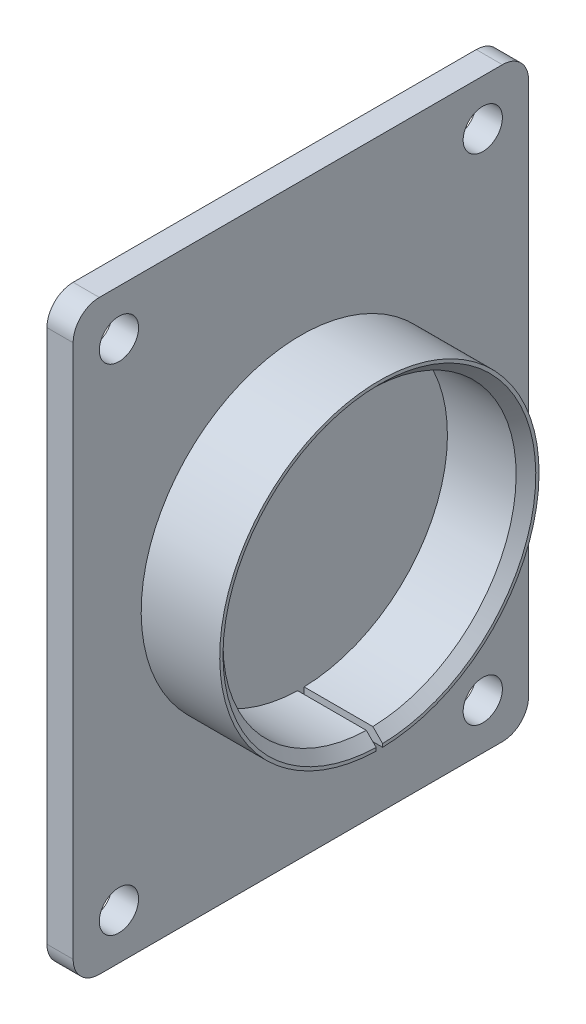
from build123d import *

# Parameters (mm, degrees)
BOSS_EXTRUDE1_DEPTH = 6
SKETCH4_W           = 44.8
SKETCH4_H           = 34.8
SKETCH4_R           = 1.5
BOSS_EXTRUDE3_DEPTH = 2
FILLET1_R           = 2
CHAMFER1_SIZE       = 0.75


with BuildPart() as part:
    # Sketch1 → Boss-Extrude1 (new body)
    with BuildSketch(Plane.YZ):
        with BuildLine():
            Line((-12.197438256, -0.25), (-11.197209474, -0.25))
            ThreePointArc((-11.197209474, -0.25), (11.2, 0), (-11.197209474, 0.25))
            Line((-11.197209474, 0.25), (-12.197438256, 0.25))
            ThreePointArc((-12.197438256, 0.25), (12.2, 0), (-12.197438256, -0.25))
        make_face()
    extrude(amount=BOSS_EXTRUDE1_DEPTH)

    # Sketch4 → Boss-Extrude3 (add)
    with BuildSketch(Plane(origin=(0, 0, 0), x_dir=(0, -1, 0), z_dir=(-1, 0, 0))):
        Rectangle(SKETCH4_W, SKETCH4_H)
        with Locations((-18.9, 13.9)):
            Circle(SKETCH4_R, mode=Mode.SUBTRACT)
        with Locations((18.9, 13.9)):
            Circle(SKETCH4_R, mode=Mode.SUBTRACT)
        with Locations((-18.9, -13.9)):
            Circle(SKETCH4_R, mode=Mode.SUBTRACT)
        with Locations((18.9, -13.9)):
            Circle(SKETCH4_R, mode=Mode.SUBTRACT)
    extrude(amount=BOSS_EXTRUDE3_DEPTH)

    # Fillet1
    fillet1_edges = [part.edges().sort_by_distance(p)[0] for p in [
        (-1, -22.4, 17.4),
        (-1, -22.4, -17.4),
        (-1, 22.4, -17.4),
        (-1, 22.4, 17.4),
    ]]
    fillet(fillet1_edges, radius=FILLET1_R)

    # Chamfer1
    chamfer1_edges = [part.edges().sort_by_distance(p)[0] for p in [
        (6, 11.2, 0),
    ]]
    chamfer(chamfer1_edges, length=CHAMFER1_SIZE)


solid = part.part
